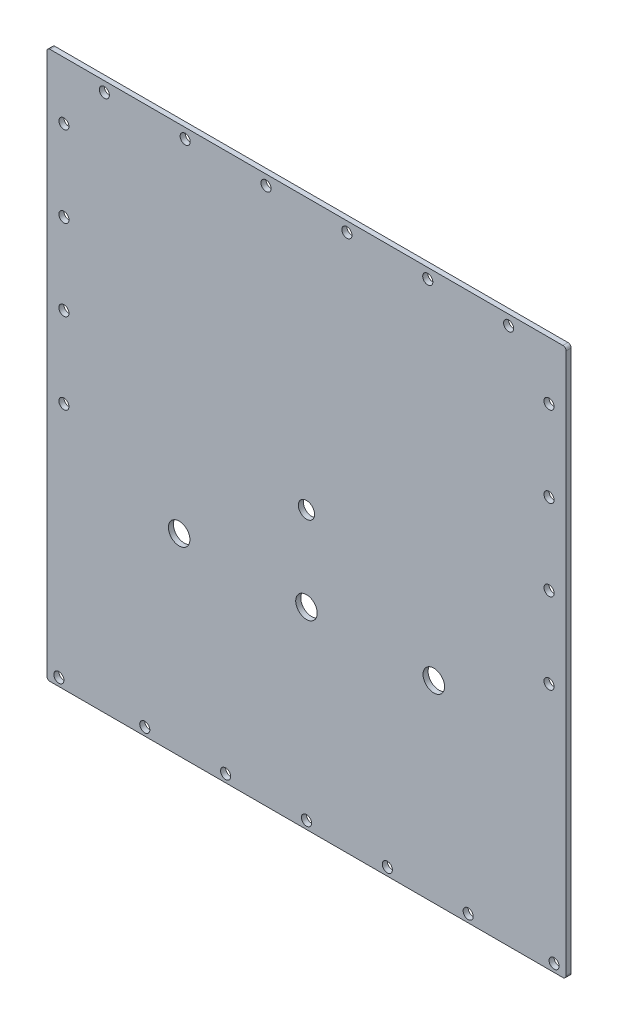
from build123d import *

# Parameters (mm, degrees)
SKETCH2_W               = 163.1
SKETCH2_H               = 171.98
SKETCH2_R               = 1.5875
SKETCH2_R_2             = 2.5527
BOSS_EXTRUDE2_DEPTH     = 1.5875
FILLET1_R               = 1
CUT_EXTRUDE1_DEPTH      = 238.715061694
CUT_EXTRUDE1_DEPTH_BACK = 238.715061694
SKETCH3_R               = 3.38


with BuildPart() as part:
    # Sketch2 → Boss-Extrude2 (new body)
    with BuildSketch(Plane.XY):
        with Locations((82.55, -85.99)):
            Rectangle(SKETCH2_W, SKETCH2_H)
        with Locations((4.7625, -169.48)):
            Circle(SKETCH2_R, mode=Mode.SUBTRACT)
        with Locations((31.75, -169.48)):
            Circle(SKETCH2_R, mode=Mode.SUBTRACT)
        with Locations((57.15, -169.48)):
            Circle(SKETCH2_R, mode=Mode.SUBTRACT)
        with Locations((6.35, -94.25)):
            Circle(SKETCH2_R, mode=Mode.SUBTRACT)
        with Locations((82.55, -169.48)):
            Circle(SKETCH2_R, mode=Mode.SUBTRACT)
        with Locations((107.95, -169.48)):
            Circle(SKETCH2_R, mode=Mode.SUBTRACT)
        with Locations((133.35, -169.48)):
            Circle(SKETCH2_R, mode=Mode.SUBTRACT)
        with Locations((160.3375, -169.48)):
            Circle(SKETCH2_R, mode=Mode.SUBTRACT)
        with Locations((158.75, -94.25)):
            Circle(SKETCH2_R, mode=Mode.SUBTRACT)
        with Locations((6.35, -68.85)):
            Circle(SKETCH2_R, mode=Mode.SUBTRACT)
        with Locations((6.35, -43.45)):
            Circle(SKETCH2_R, mode=Mode.SUBTRACT)
        with Locations((6.35, -18.05)):
            Circle(SKETCH2_R, mode=Mode.SUBTRACT)
        with Locations((19.05, -3.175)):
            Circle(SKETCH2_R, mode=Mode.SUBTRACT)
        with Locations((44.45, -3.175)):
            Circle(SKETCH2_R, mode=Mode.SUBTRACT)
        with Locations((69.85, -3.175)):
            Circle(SKETCH2_R, mode=Mode.SUBTRACT)
        with Locations((82.55, -85)):
            Circle(SKETCH2_R_2, mode=Mode.SUBTRACT)
        with Locations((158.75, -68.85)):
            Circle(SKETCH2_R, mode=Mode.SUBTRACT)
        with Locations((95.25, -3.175)):
            Circle(SKETCH2_R, mode=Mode.SUBTRACT)
        with Locations((120.65, -3.175)):
            Circle(SKETCH2_R, mode=Mode.SUBTRACT)
        with Locations((158.75, -43.45)):
            Circle(SKETCH2_R, mode=Mode.SUBTRACT)
        with Locations((158.75, -18.05)):
            Circle(SKETCH2_R, mode=Mode.SUBTRACT)
        with Locations((146.05, -3.175)):
            Circle(SKETCH2_R, mode=Mode.SUBTRACT)
    extrude(amount=BOSS_EXTRUDE2_DEPTH)

    # Fillet1
    fillet1_edges = [part.edges().sort_by_distance(p)[0] for p in [
        (1, -171.98, 0.79375),
        (1, 0, 0.79375),
        (164.1, 0, 0.79375),
        (164.1, -171.98, 0.79375),
    ]]
    fillet(fillet1_edges, radius=FILLET1_R)

    # Sketch3 → Cut-Extrude1 (cut, two sides: drawn at the far end of the back side and taken through both)
    with BuildSketch(Plane.XY.offset(1.5875).offset(-CUT_EXTRUDE1_DEPTH_BACK)):
        with Locations((42.55, -111.45096)):
            Circle(SKETCH3_R)
        with Locations((82.55, -111.45096)):
            Circle(SKETCH3_R)
        with Locations((122.55, -111.45096)):
            Circle(SKETCH3_R)
    extrude(amount=CUT_EXTRUDE1_DEPTH + CUT_EXTRUDE1_DEPTH_BACK, mode=Mode.SUBTRACT)


solid = part.part
